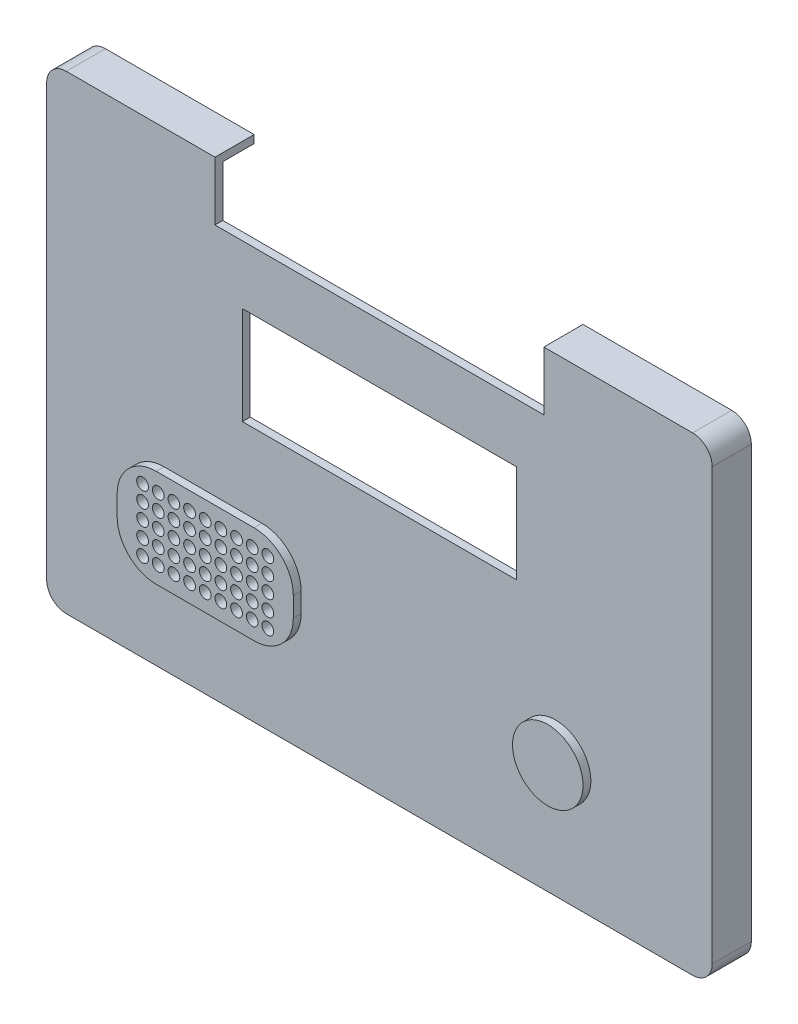
from build123d import *

# Parameters (mm, degrees)
SKETCH1_W               = 170
SKETCH1_H               = 120
BOSS_EXTRUDE1_DEPTH     = 10
SHELL1_T                = -2
FILLET1_R               = 5
SKETCH2_R               = 7
CUT_EXTRUDE1_DEPTH      = 209.32666656
SKETCH3_R               = 9
BOSS_EXTRUDE2_DEPTH     = 2
SKETCH4_W               = 70
SKETCH4_H               = 25
CUT_EXTRUDE2_DEPTH      = 209.32666656
SKETCH10_W              = 45
SKETCH10_H              = 25
BOSS_EXTRUDE4_DEPTH     = 2
FILL_START              = -2
FILL_PATTERN2_OUTLINE_R = 1.5
FILL_PATTERN2_DEPTH     = 4
FILLET2_R               = 10
SKETCH11_W              = 84
SKETCH11_H              = 15
CUT_EXTRUDE3_DEPTH      = 209.32666656


# Read off the part's stored shape, not the designer's step: Fill Pattern2
with BuildPart() as part:
    # Sketch1 → Boss-Extrude1 (new body)
    with BuildSketch(Plane.XY):
        with Locations((85, 60)):
            Rectangle(SKETCH1_W, SKETCH1_H)
    extrude(amount=-BOSS_EXTRUDE1_DEPTH)

    # Shell1
    shell1_openings = [part.faces().sort_by_distance(p)[0] for p in [
        (85, 60, -10),
    ]]
    offset(amount=SHELL1_T, openings=shell1_openings, kind=Kind.INTERSECTION)

    # Fillet1
    fillet1_edges = [part.edges().sort_by_distance(p)[0] for p in [
        (2, 2, -6),
        (2, 118, -6),
        (168, 118, -6),
        (168, 2, -6),
        (0, 120, -5),
        (170, 120, -5),
        (170, 0, -5),
        (0, 0, -5),
    ]]
    fillet(fillet1_edges, radius=FILLET1_R)

    # Sketch2 → Cut-Extrude1 (cut, through all)
    with BuildSketch(Plane.XY):
        with Locations((130, 30)):
            Circle(SKETCH2_R)
    extrude(amount=-CUT_EXTRUDE1_DEPTH, mode=Mode.SUBTRACT)

    # Sketch3 → Boss-Extrude2 (add)
    with BuildSketch(Plane.XY):
        with Locations(Location((130, 30, 0), (0, 0, 180))):
            Circle(SKETCH3_R)
    extrude(amount=BOSS_EXTRUDE2_DEPTH)

    # Sketch4 → Cut-Extrude2 (cut, through all)
    with BuildSketch(Plane.XY):
        with Locations((85, 77.5)):
            Rectangle(SKETCH4_W, SKETCH4_H)
    extrude(amount=-CUT_EXTRUDE2_DEPTH, mode=Mode.SUBTRACT)

    # Sketch10 → Boss-Extrude4 (add)
    with BuildSketch(Plane.XY):
        with Locations((42.5, 32.5)):
            Rectangle(SKETCH10_W, SKETCH10_H)
    extrude(amount=BOSS_EXTRUDE4_DEPTH)

    # Fill Pattern2 outline → Fill Pattern2 (cut)
    with BuildSketch(Plane.XY.offset(FILL_START)):
        with Locations((42.5, 32.5)):
            Circle(FILL_PATTERN2_OUTLINE_R)
        with Locations((30.5, 32.5)):
            Circle(FILL_PATTERN2_OUTLINE_R)
        with Locations((30.5, 36.5)):
            Circle(FILL_PATTERN2_OUTLINE_R)
        with Locations((30.5, 40.5)):
            Circle(FILL_PATTERN2_OUTLINE_R)
        with Locations((26.5, 24.5)):
            Circle(FILL_PATTERN2_OUTLINE_R)
        with Locations((30.5, 24.5)):
            Circle(FILL_PATTERN2_OUTLINE_R)
        with Locations((42.5, 40.5)):
            Circle(FILL_PATTERN2_OUTLINE_R)
        with Locations((30.5, 28.5)):
            Circle(FILL_PATTERN2_OUTLINE_R)
        with Locations((46.5, 40.5)):
            Circle(FILL_PATTERN2_OUTLINE_R)
        with Locations((26.5, 28.5)):
            Circle(FILL_PATTERN2_OUTLINE_R)
        with Locations((26.5, 32.5)):
            Circle(FILL_PATTERN2_OUTLINE_R)
        with Locations((26.5, 36.5)):
            Circle(FILL_PATTERN2_OUTLINE_R)
        with Locations((26.5, 40.5)):
            Circle(FILL_PATTERN2_OUTLINE_R)
        with Locations((54.5, 32.5)):
            Circle(FILL_PATTERN2_OUTLINE_R)
        with Locations((50.5, 28.5)):
            Circle(FILL_PATTERN2_OUTLINE_R)
        with Locations((42.5, 28.5)):
            Circle(FILL_PATTERN2_OUTLINE_R)
        with Locations((58.5, 40.5)):
            Circle(FILL_PATTERN2_OUTLINE_R)
        with Locations((54.5, 28.5)):
            Circle(FILL_PATTERN2_OUTLINE_R)
        with Locations((50.5, 24.5)):
            Circle(FILL_PATTERN2_OUTLINE_R)
        with Locations((38.5, 28.5)):
            Circle(FILL_PATTERN2_OUTLINE_R)
        with Locations((58.5, 36.5)):
            Circle(FILL_PATTERN2_OUTLINE_R)
        with Locations((50.5, 36.5)):
            Circle(FILL_PATTERN2_OUTLINE_R)
        with Locations((46.5, 32.5)):
            Circle(FILL_PATTERN2_OUTLINE_R)
        with Locations((50.5, 40.5)):
            Circle(FILL_PATTERN2_OUTLINE_R)
        with Locations((46.5, 36.5)):
            Circle(FILL_PATTERN2_OUTLINE_R)
        with Locations((54.5, 36.5)):
            Circle(FILL_PATTERN2_OUTLINE_R)
        with Locations((50.5, 32.5)):
            Circle(FILL_PATTERN2_OUTLINE_R)
        with Locations((46.5, 28.5)):
            Circle(FILL_PATTERN2_OUTLINE_R)
        with Locations((54.5, 40.5)):
            Circle(FILL_PATTERN2_OUTLINE_R)
        with Locations((42.5, 36.5)):
            Circle(FILL_PATTERN2_OUTLINE_R)
        with Locations((38.5, 24.5)):
            Circle(FILL_PATTERN2_OUTLINE_R)
        with Locations((34.5, 24.5)):
            Circle(FILL_PATTERN2_OUTLINE_R)
        with Locations((34.5, 28.5)):
            Circle(FILL_PATTERN2_OUTLINE_R)
        with Locations((34.5, 32.5)):
            Circle(FILL_PATTERN2_OUTLINE_R)
        with Locations((34.5, 36.5)):
            Circle(FILL_PATTERN2_OUTLINE_R)
        with Locations((34.5, 40.5)):
            Circle(FILL_PATTERN2_OUTLINE_R)
        with Locations((38.5, 40.5)):
            Circle(FILL_PATTERN2_OUTLINE_R)
        with Locations((58.5, 32.5)):
            Circle(FILL_PATTERN2_OUTLINE_R)
        with Locations((38.5, 32.5)):
            Circle(FILL_PATTERN2_OUTLINE_R)
        with Locations((46.5, 24.5)):
            Circle(FILL_PATTERN2_OUTLINE_R)
        with Locations((54.5, 24.5)):
            Circle(FILL_PATTERN2_OUTLINE_R)
        with Locations((58.5, 28.5)):
            Circle(FILL_PATTERN2_OUTLINE_R)
        with Locations((38.5, 36.5)):
            Circle(FILL_PATTERN2_OUTLINE_R)
        with Locations((42.5, 24.5)):
            Circle(FILL_PATTERN2_OUTLINE_R)
        with Locations((58.5, 24.5)):
            Circle(FILL_PATTERN2_OUTLINE_R)
    extrude(amount=FILL_PATTERN2_DEPTH, mode=Mode.SUBTRACT)

    # Fillet2
    fillet2_edges = [part.edges().sort_by_distance(p)[0] for p in [
        (20, 45, 1),
        (20, 20, 1),
        (65, 20, 1),
        (65, 45, 1),
    ]]
    fillet(fillet2_edges, radius=FILLET2_R)

    # Sketch11 → Cut-Extrude3 (cut, through all)
    with BuildSketch(Plane.XY):
        with Locations((85, 112.5)):
            Rectangle(SKETCH11_W, SKETCH11_H)
    extrude(amount=-CUT_EXTRUDE3_DEPTH, mode=Mode.SUBTRACT)


solid = part.part
